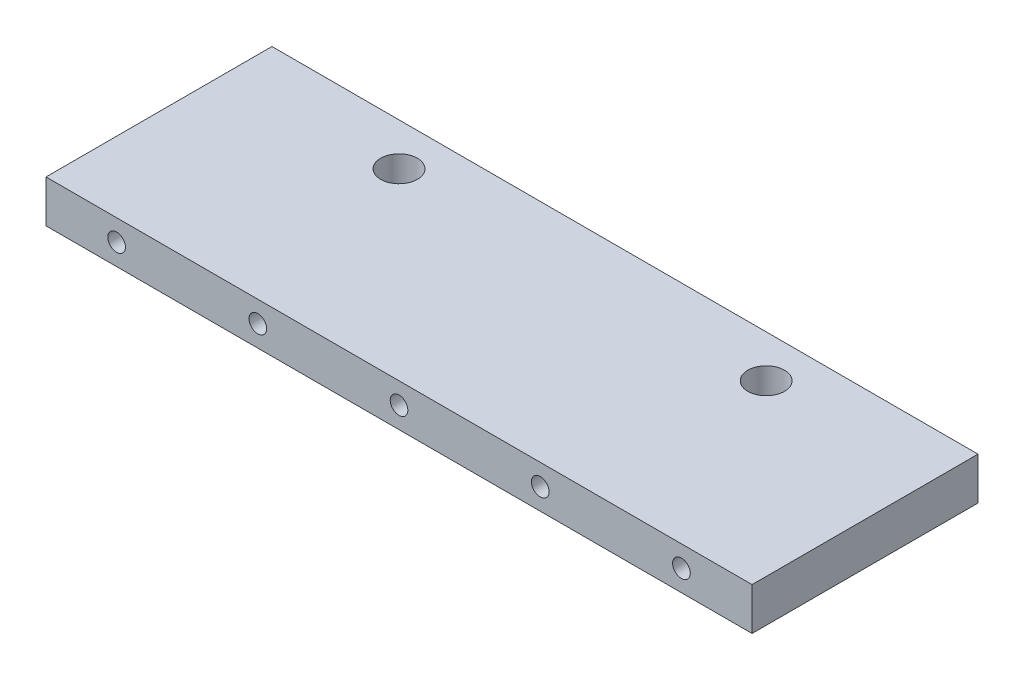
from build123d import *

# Parameters (mm, degrees)
SKETCH1_W                    = 100
SKETCH1_H                    = 32
BOSS_EXTRUDE1_DEPTH          = 6
TAP_DRILL_FOR_M3_TAP1_D      = 2.5
TAP_DRILL_FOR_M5_HELICOIL1_D = 5.2


with BuildPart() as part:
    # Sketch1 → Boss-Extrude1 (new body)
    with BuildSketch(Plane(origin=(0, 0, 0), x_dir=(1, 0, 0), z_dir=(0, 1, 0))):
        with Locations((50, 16)):
            Rectangle(SKETCH1_W, SKETCH1_H)
    extrude(amount=BOSS_EXTRUDE1_DEPTH)

    # Tap Drill for M3 Tap1 (through all)
    with Locations(Plane(origin=(0, 0, -32), x_dir=(-1, 0, 0), z_dir=(0, 0, -1))):
        with Locations((-90, 3), (-70, 3), (-50, 3), (-30, 3), (-10, 3)):
            Hole(TAP_DRILL_FOR_M3_TAP1_D / 2)

    # Tap Drill for M5 Helicoil1 (through all)
    with Locations(Plane(origin=(0, 6, 0), x_dir=(1, 0, 0), z_dir=(0, 1, 0))):
        with Locations((24, 26), (76, 26)):
            Hole(TAP_DRILL_FOR_M5_HELICOIL1_D / 2)


solid = part.part
